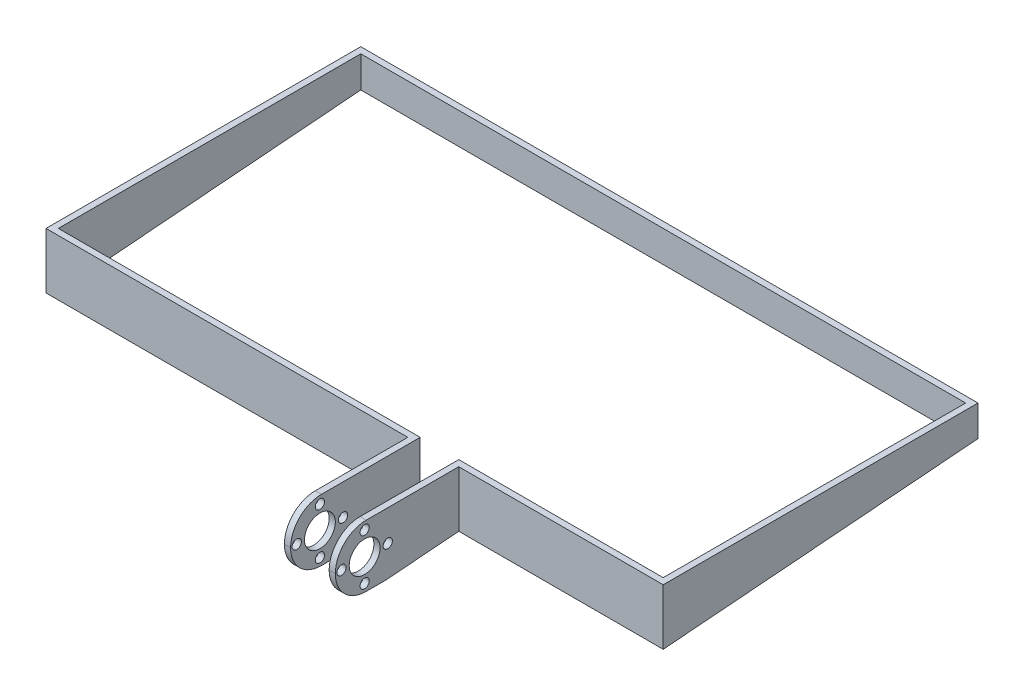
from build123d import *

# Parameters (mm, degrees)
EXTRUDE_1_DEPTH          = 20
CUT_EXTRUDE_1_DEPTH      = 160.088219443
CUT_EXTRUDE_1_DEPTH_BACK = 160.088219443
SKETCH_6_R               = 5
SKETCH_6_3_R             = 1.5
CUT_EXTRUDE_2_DEPTH      = 160.088219443
PATTERN_CIRCULAR_1_COUNT = 4
FILLET_1_R               = 10
CUT_EXTRUDE_3_DEPTH      = 218.761335102
CUT_EXTRUDE_3_DEPTH_BACK = 218.761335102
EXTRUDE_START            = -98
EXTRUDE_2_DEPTH          = 117.25
EXTRUDE_START_2          = 31.75
EXTRUDE_2_2_DEPTH        = 66.25
EXTRUDE_START_3          = 17.25
EXTRUDE_2_3_DEPTH        = 2
EXTRUDE_2_4_DEPTH        = 2
CUT_EXTRUDE_4_DEPTH      = 132.984844075
CUT_EXTRUDE_4_DEPTH_BACK = 132.984844075
SKETCH_12_W              = 119.060862832
SKETCH_12_H              = 18
SKETCH_12_W_2            = 69.668977306


# Read off the part's stored shape, not the designer's step: 凸台-拉伸2
with BuildPart() as part:
    # 草图2 → 凸台-拉伸1 (new body)
    with BuildSketch(Plane(origin=(0, 0, 0), x_dir=(1, 0, 0), z_dir=(0, 1, 0))):
        Polygon((17.25, -36.214565314), (-100, -36.214565314), (-100, 83.785434686), (100, 83.785434686), (100, -36.214565314), (33.75, -36.214565314), (33.75, -58.214565314), (31.75, -58.214565314), (31.75, -34.214565314), (98, -34.214565314), (98, 81.785434686), (-98, 81.785434686), (-98, -34.214565314), (19.25, -34.214565314), (19.25, -58.214565314), (17.25, -58.214565314), align=None)
    extrude(amount=EXTRUDE_1_DEPTH)

    # 草图6 → 切除-拉伸1 (cut, two sides: drawn at the far end of the back side and taken through both)
    with BuildSketch(Plane(origin=(33.75, 0, 0), x_dir=(0, 0, -1), z_dir=(1, 0, 0)).offset(-CUT_EXTRUDE_1_DEPTH_BACK)):
        with Locations((-48.714565314, 10)):
            Circle(SKETCH_6_R)
    extrude(amount=CUT_EXTRUDE_1_DEPTH + CUT_EXTRUDE_1_DEPTH_BACK, mode=Mode.SUBTRACT)

    # 草图6<3> → 切除-拉伸2 (cut, symmetric)
    with BuildSketch(Plane(origin=(33.75, 0, 0), x_dir=(0, 0, -1), z_dir=(1, 0, 0))):
        with Locations((-48.714565314, 17.5)):
            Circle(SKETCH_6_3_R)
    cut_extrude_2 = extrude(amount=CUT_EXTRUDE_2_DEPTH, both=True, mode=Mode.SUBTRACT)

    # 阵列(圆周)1: 切除-拉伸2 ×4 about axis
    pattern_circular_1_axis = Axis((0, 10, 48.714565314), (1, 0, 0))
    for i in range(1, PATTERN_CIRCULAR_1_COUNT):
        add(cut_extrude_2.rotate(pattern_circular_1_axis, i * 360 / PATTERN_CIRCULAR_1_COUNT), mode=Mode.SUBTRACT)

    # 圆角1
    fillet_1_edges = [part.edges().sort_by_distance(p)[0] for p in [
        (32.75, 20, 58.214565314),
        (32.75, 0, 58.214565314),
        (18.25, 0, 58.214565314),
        (18.25, 20, 58.214565314),
    ]]
    fillet(fillet_1_edges, radius=FILLET_1_R - 0.0001)  # a hair under: the kernel refuses the full size

    # 草图8 → 切除-拉伸3 (cut, two sides: drawn at the far end of the back side and taken through both)
    with BuildSketch(Plane.ZY.offset(100).offset(-CUT_EXTRUDE_3_DEPTH_BACK)):
        Polygon((41.803939726, 0), (-83.785434686, 10), (-83.785434686, 0), align=None)
    extrude(amount=CUT_EXTRUDE_3_DEPTH + CUT_EXTRUDE_3_DEPTH_BACK, mode=Mode.SUBTRACT)

    # 凸台-拉伸2 outline → 凸台-拉伸2 (add)
    with BuildSketch(Plane.YZ.offset(EXTRUDE_START)):
        Polygon((20, 16.214565314), (20, 18.214565314), (1.878293807, 18.214565314), (2.037542948, 16.214565314), align=None)
    extrude(amount=EXTRUDE_2_DEPTH)

    # Extrude 2 2 outline → Extrude 2 2 (add)
    with BuildSketch(Plane.YZ.offset(EXTRUDE_START_2)):
        Polygon((20, 16.214565314), (20, 18.214565314), (1.878293807, 18.214565314), (2.037542948, 16.214565314), align=None)
    extrude(amount=EXTRUDE_2_2_DEPTH)

    # Extrude 2 3 outline → Extrude 2 3 (add)
    with BuildSketch(Plane.YZ.offset(EXTRUDE_START_3)):
        Polygon((20, 18.214565314), (20, 34.214565314), (0.604300678, 34.214565314), (1.878293807, 18.214565314), align=None)
    extrude(amount=EXTRUDE_2_3_DEPTH)

    # Extrude 2 4 outline → Extrude 2 4 (add)
    with BuildSketch(Plane.YZ.offset(EXTRUDE_START_2)):
        Polygon((20, 18.214565314), (20, 34.214565314), (0.604300678, 34.214565314), (1.878293807, 18.214565314), align=None)
    extrude(amount=EXTRUDE_2_4_DEPTH)

    # 草图12 → 切除-拉伸4 (cut, two sides: drawn at the far end of the back side and taken through both)
    with BuildSketch(Plane(origin=(0, 0, 0), x_dir=(1, 0, 0), z_dir=(0, 1, 0)).offset(-CUT_EXTRUDE_4_DEPTH_BACK)):
        with Locations((-42.280431416, -27.214565314)):
            Rectangle(SKETCH_12_W, SKETCH_12_H)
        with Locations((68.584488653, -27.214565314)):
            Rectangle(SKETCH_12_W_2, SKETCH_12_H)
    extrude(amount=CUT_EXTRUDE_4_DEPTH + CUT_EXTRUDE_4_DEPTH_BACK, mode=Mode.SUBTRACT)


solid = part.part
